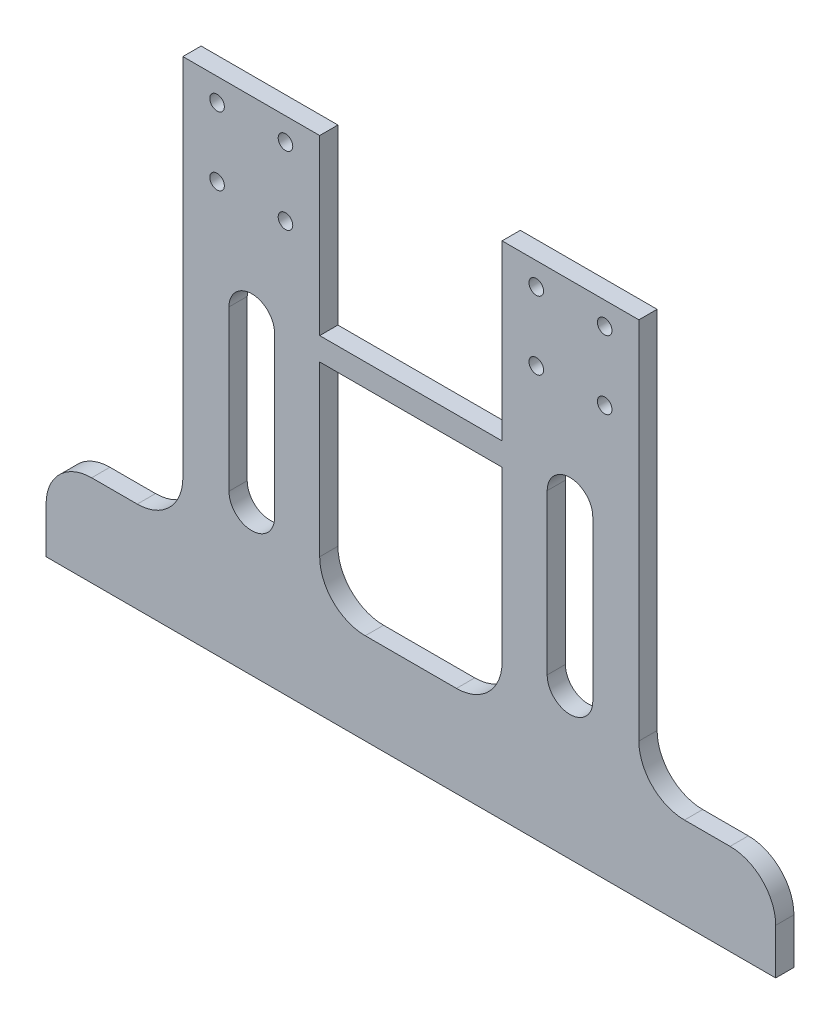
from build123d import *

# Parameters (mm, degrees)
SKETCH1_R           = 1.6
BOSS_EXTRUDE1_DEPTH = 4


with BuildPart() as part:
    # Sketch1 → Boss-Extrude1 (new body)
    with BuildSketch(Plane.XY):
        with BuildLine():
            Line((20, 62), (20, 100))
            Line((20, 100), (50, 100))
            Line((50, 100), (50, 20))
            ThreePointArc((50, 20), (52.928932188, 12.928932188), (60, 10))
            Line((60, 10), (70, 10))
            ThreePointArc((70, 10), (77.071067812, 7.071067812), (80, 0))
            Line((80, 0), (80, -10))
            Line((80, -10), (50, -10))
            Line((50, -10), (-50, -10))
            Line((-50, -10), (-80, -10))
            Line((-80, -10), (-80, 0))
            ThreePointArc((-80, 0), (-77.071067812, 7.071067812), (-70, 10))
            Line((-70, 10), (-60, 10))
            ThreePointArc((-60, 10), (-52.928932188, 12.928932188), (-50, 20))
            Line((-50, 20), (-50, 100))
            Line((-50, 100), (-20, 100))
            Line((-20, 100), (-20, 62))
            Line((-20, 62), (20, 62))
        make_face()
        with Locations((-42.5, 95)):
            Circle(SKETCH1_R, mode=Mode.SUBTRACT)
        with Locations((-27.5, 95)):
            Circle(SKETCH1_R, mode=Mode.SUBTRACT)
        with Locations((-42.5, 80)):
            Circle(SKETCH1_R, mode=Mode.SUBTRACT)
        with Locations((-27.5, 80)):
            Circle(SKETCH1_R, mode=Mode.SUBTRACT)
        with Locations((42.5, 80)):
            Circle(SKETCH1_R, mode=Mode.SUBTRACT)
        with Locations((27.5, 80)):
            Circle(SKETCH1_R, mode=Mode.SUBTRACT)
        with Locations((27.5, 95)):
            Circle(SKETCH1_R, mode=Mode.SUBTRACT)
        with Locations((42.5, 95)):
            Circle(SKETCH1_R, mode=Mode.SUBTRACT)
        with BuildLine():
            Line((20, 20), (20, 57))
            Line((20, 57), (-20, 57))
            Line((-20, 57), (-20, 20))
            ThreePointArc((-20, 20), (-17.071067812, 12.928932188), (-10, 10))
            Line((-10, 10), (10, 10))
            ThreePointArc((10, 10), (17.071067812, 12.928932188), (20, 20))
        make_face(mode=Mode.SUBTRACT)
        with BuildLine():
            Line((-29.890194043, 57.5), (-29.890194043, 22.5))
            ThreePointArc((-29.890194043, 22.5), (-34.890194043, 17.5), (-39.890194043, 22.5))
            Line((-39.890194043, 22.5), (-39.890194043, 57.5))
            ThreePointArc((-39.890194043, 57.5), (-34.890194043, 62.5), (-29.890194043, 57.5))
        make_face(mode=Mode.SUBTRACT)
        with BuildLine():
            Line((29.890194043, 57.5), (29.890194043, 22.5))
            ThreePointArc((29.890194043, 22.5), (34.890194043, 17.5), (39.890194043, 22.5))
            Line((39.890194043, 22.5), (39.890194043, 57.5))
            ThreePointArc((39.890194043, 57.5), (34.890194043, 62.5), (29.890194043, 57.5))
        make_face(mode=Mode.SUBTRACT)
    extrude(amount=BOSS_EXTRUDE1_DEPTH)


solid = part.part
